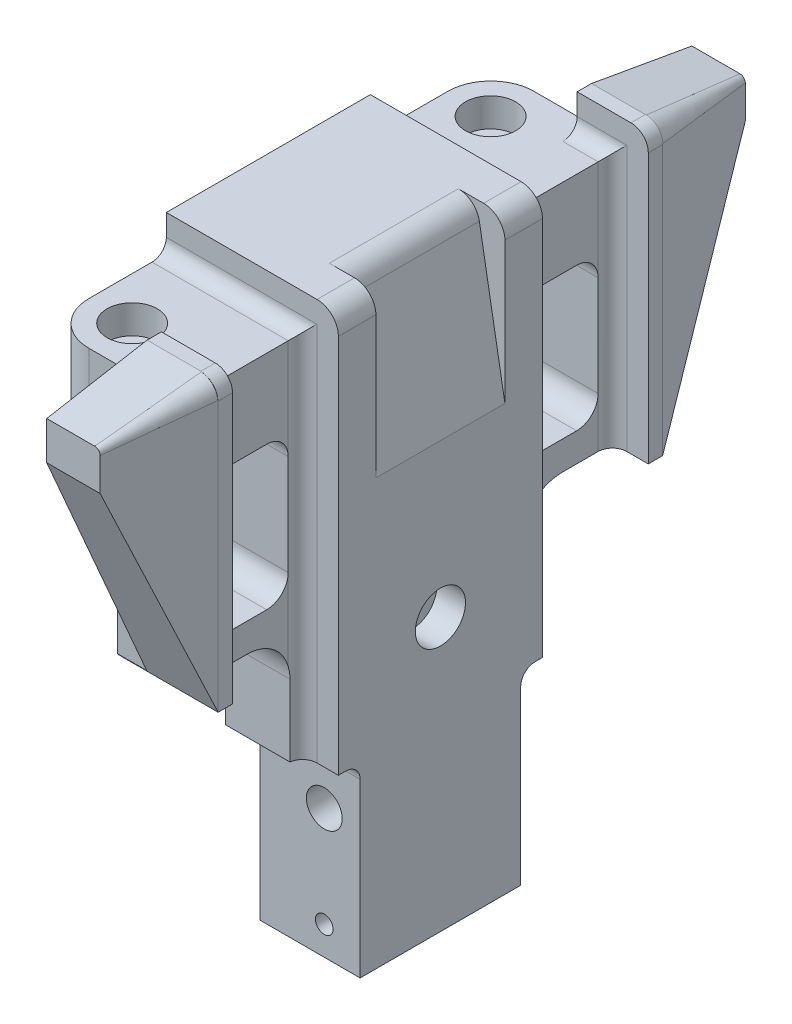
from build123d import *

# Parameters (mm, degrees)
SKETCH1_W                                        = 38.1
SKETCH1_H                                        = 130.175
BOSS_EXTRUDE1_DEPTH                              = 71.4375
CUT_EXTRUDE1_DEPTH                               = 104.881225746
CUT_EXTRUDE2_DEPTH                               = 104.881225746
CUT_EXTRUDE3_DEPTH                               = 104.881225746
CUT_EXTRUDE5_DEPTH                               = 143.857360022
CUT_EXTRUDE5_DEPTH_BACK                          = 143.857360022
SKETCH6_W                                        = 22.352
SKETCH6_H                                        = 28.575
CUT_EXTRUDE6_DEPTH                               = 7.9375
SKETCH7_W                                        = 22.352
SKETCH7_H                                        = 22.1615
CUT_EXTRUDE7_DEPTH                               = 143.857360035
CUT_EXTRUDE8_DEPTH                               = 150.705542767
FILLET1_R                                        = 9.525
CUT_EXTRUDE9_DEPTH                               = 14.2875
FILLET3_R                                        = 4.73075
CUT_EXTRUDE12_DEPTH                              = 104.881225783
CUT_EXTRUDE13_DEPTH                              = 104.881225783
F_5_16_0_3125_DIAMETER_HOLE2_D                   = 7.9375
F_5_16_0_3125_DIAMETER_HOLE2_DEPTH               = 11.684
F_5_16_0_3125_DIAMETER_HOLE2_TIP                 = 2.384665582
F_23_0_154_DIAMETER_HOLE2_D                      = 3.9116
F_23_0_154_DIAMETER_HOLE2_DEPTH                  = 11.684
F_23_0_154_DIAMETER_HOLE2_TIP                    = 1.175163199
F_8_32_TAPPED_HOLE1_REACH                        = 125.996
F_8_32_TAPPED_HOLE1_BORE_R                       = 1.7272
CUT_EXTRUDE14_DEPTH                              = 99.501784584
CUT_EXTRUDE15_DEPTH                              = 104.881225746
FILLET5_R                                        = 3.8354
CBORE_FOR_1_4_SOCKET_HEAD_CAP_SCREW1_D           = 6.7564
CBORE_FOR_1_4_SOCKET_HEAD_CAP_SCREW1_CBORE_D     = 11.1125
CBORE_FOR_1_4_SOCKET_HEAD_CAP_SCREW1_CBORE_DEPTH = 6.35
CBORE_FOR_1_4_SOCKET_HEAD_CAP_SCREW2_D           = 6.7564
CBORE_FOR_1_4_SOCKET_HEAD_CAP_SCREW2_CBORE_D     = 11.1125
CBORE_FOR_1_4_SOCKET_HEAD_CAP_SCREW2_CBORE_DEPTH = 6.35


with BuildPart() as part:
    # Sketch1 → Boss-Extrude1 (new body)
    with BuildSketch(Plane.XY):
        Rectangle(SKETCH1_W, SKETCH1_H)
    extrude(amount=-BOSS_EXTRUDE1_DEPTH)

    # Sketch2 → Cut-Extrude1 (cut, through all)
    with BuildSketch(Plane(origin=(19.05, 0, 0), x_dir=(0, 0, -1), z_dir=(1, 0, 0))):
        with BuildLine():
            Line((71.4375, 1.5875), (34.925, 1.5875))
            ThreePointArc((34.925, 1.5875), (28.189807909, -1.202307909), (25.4, -7.9375))
            Line((25.4, -7.9375), (25.4, -65.0875))
            Line((25.4, -65.0875), (71.4375, -65.0875))
            Line((71.4375, -65.0875), (71.4375, 1.5875))
        make_face()
    extrude(amount=-CUT_EXTRUDE1_DEPTH, mode=Mode.SUBTRACT)

    # Sketch3 → Cut-Extrude2 (cut, through all)
    with BuildSketch(Plane(origin=(19.05, 0, 0), x_dir=(0, 0, -1), z_dir=(1, 0, 0))):
        with BuildLine():
            Line((25.4, -23.8125), (20.955, -23.8125))
            ThreePointArc((20.955, -23.8125), (18.70993597, -24.74243597), (17.78, -26.9875))
            Line((17.78, -26.9875), (17.78, -65.0875))
            Line((17.78, -65.0875), (25.4, -65.0875))
            Line((25.4, -65.0875), (25.4, -23.8125))
        make_face()
    extrude(amount=-CUT_EXTRUDE2_DEPTH, mode=Mode.SUBTRACT)

    # Sketch4 → Cut-Extrude3 (cut, through all)
    with BuildSketch(Plane(origin=(19.05, 0, 0), x_dir=(0, 0, -1), z_dir=(1, 0, 0))):
        with BuildLine():
            Line((22.5933, 65.0875), (46.0375, 65.0875))
            Line((46.0375, 65.0875), (46.0375, 60.325))
            ThreePointArc((46.0375, 60.325), (45.10756403, 58.07993597), (42.8625, 57.15))
            Line((42.8625, 57.15), (25.7683, 57.15))
            ThreePointArc((25.7683, 57.15), (23.52323597, 58.07993597), (22.5933, 60.325))
            Line((22.5933, 60.325), (22.5933, 65.0875))
        make_face()
    extrude(amount=-CUT_EXTRUDE3_DEPTH, mode=Mode.SUBTRACT)

    # Sketch5 → Cut-Extrude5 (cut, two sides: drawn at the far end of the back side and taken through both)
    with BuildSketch(Plane(origin=(0, 57.15, 0), x_dir=(1, 0, 0), z_dir=(0, 1, 0)).offset(-CUT_EXTRUDE5_DEPTH_BACK)):
        with BuildLine():
            Line((19.05, 46.0375), (14.2875, 46.0375))
            ThreePointArc((14.2875, 46.0375), (12.04243597, 45.10756403), (11.1125, 42.8625))
            Line((11.1125, 42.8625), (11.1125, 25.7683))
            ThreePointArc((11.1125, 25.7683), (12.04243597, 23.52323597), (14.2875, 22.5933))
            Line((14.2875, 22.5933), (19.05, 22.5933))
            Line((19.05, 22.5933), (19.05, 46.0375))
        make_face()
    extrude(amount=CUT_EXTRUDE5_DEPTH + CUT_EXTRUDE5_DEPTH_BACK, mode=Mode.SUBTRACT)

    # Sketch6 → Cut-Extrude6 (cut)
    with BuildSketch(Plane(origin=(0, 65.0875, 0), x_dir=(1, 0, 0), z_dir=(0, 1, 0))):
        with Locations((-7.874, 57.15)):
            Rectangle(SKETCH6_W, SKETCH6_H)
    extrude(amount=-CUT_EXTRUDE6_DEPTH, mode=Mode.SUBTRACT)

    # Sketch7 → Cut-Extrude7 (cut, through all)
    with BuildSketch(Plane(origin=(0, 57.15, 0), x_dir=(1, 0, 0), z_dir=(0, 1, 0))):
        with Locations((-7.874, 60.35675)):
            Rectangle(SKETCH7_W, SKETCH7_H)
    extrude(amount=-CUT_EXTRUDE7_DEPTH, mode=Mode.SUBTRACT)

    # Sketch8 → Cut-Extrude8 (cut, through all)
    with BuildSketch(Plane(origin=(0, 65.0875, 0), x_dir=(1, 0, 0), z_dir=(0, 1, 0))):
        Polygon((15.131132854, 71.4375), (19.05, 71.4375), (19.05, 49.2125), align=None)
    extrude(amount=-CUT_EXTRUDE8_DEPTH, mode=Mode.SUBTRACT)

    # Fillet1
    fillet1_edges = [part.edges().sort_by_distance(p)[0] for p in [
        (-19.05, 29.36875, -49.276),
    ]]
    fillet(fillet1_edges, radius=FILLET1_R)

    # Sketch9 → Cut-Extrude9 (cut)
    with BuildSketch(Plane.XY):
        Polygon((12.7, 65.0875), (19.05, 65.0875), (19.05, 29.074860445), align=None)
    extrude(amount=-CUT_EXTRUDE9_DEPTH, mode=Mode.SUBTRACT)

    # Fillet3
    fillet3_edges = [part.edges().sort_by_distance(p)[0] for p in [
        (12.7, 65.0875, -7.14375),
        (19.05, 65.0875, -18.4404),
    ]]
    fillet(fillet3_edges, radius=FILLET3_R)

    # Sketch11 → Cut-Extrude12 (cut, through all)
    with BuildSketch(Plane(origin=(19.05, 0, 0), x_dir=(0, 0, -1), z_dir=(1, 0, 0))):
        Polygon((71.4375, 52.6923), (71.4375, 1.5875), (49.2125, 1.5875), align=None)
    extrude(amount=-CUT_EXTRUDE12_DEPTH, mode=Mode.SUBTRACT)

    # Sketch12 → Cut-Extrude13 (cut, through all)
    with BuildSketch(Plane(origin=(19.05, 0, 0), x_dir=(0, 0, -1), z_dir=(1, 0, 0))):
        with BuildLine():
            Line((30.5308, 39.6875), (38.1, 39.6875))
            ThreePointArc((38.1, 39.6875), (41.467596045, 38.292596045), (42.8625, 34.925))
            Line((42.8625, 34.925), (42.8625, 12.7))
            ThreePointArc((42.8625, 12.7), (41.467596045, 9.332403955), (38.1, 7.9375))
            Line((38.1, 7.9375), (30.5308, 7.9375))
            ThreePointArc((30.5308, 7.9375), (27.163203955, 9.332403955), (25.7683, 12.7))
            Line((25.7683, 12.7), (25.7683, 34.925))
            ThreePointArc((25.7683, 34.925), (27.163203955, 38.292596045), (30.5308, 39.6875))
        make_face()
    extrude(amount=-CUT_EXTRUDE13_DEPTH, mode=Mode.SUBTRACT)

    # 5/16 (0.3125) Diameter Hole2
    with Locations(Plane(origin=(11.1125, -36.5125, -17.78), x_dir=(0, -1, 0), z_dir=(0, 0, -1))):
        with Locations((0, 0)):
            Hole(F_5_16_0_3125_DIAMETER_HOLE2_D / 2, depth=F_5_16_0_3125_DIAMETER_HOLE2_DEPTH)
            with Locations((0, 0, -(F_5_16_0_3125_DIAMETER_HOLE2_DEPTH + F_5_16_0_3125_DIAMETER_HOLE2_TIP / 2))):  # 118° drill point
                Cone(0, F_5_16_0_3125_DIAMETER_HOLE2_D / 2, F_5_16_0_3125_DIAMETER_HOLE2_TIP, mode=Mode.SUBTRACT)

    # #23 (0.154) Diameter Hole2
    with Locations(Plane(origin=(11.1125, -58.7375, -17.78), x_dir=(0, -1, 0), z_dir=(0, 0, -1))):
        with Locations((0, 0)):
            Hole(F_23_0_154_DIAMETER_HOLE2_D / 2, depth=F_23_0_154_DIAMETER_HOLE2_DEPTH)
            with Locations((0, 0, -(F_23_0_154_DIAMETER_HOLE2_DEPTH + F_23_0_154_DIAMETER_HOLE2_TIP / 2))):  # 118° drill point
                Cone(0, F_23_0_154_DIAMETER_HOLE2_D / 2, F_23_0_154_DIAMETER_HOLE2_TIP, mode=Mode.SUBTRACT)

    # #8-32 Tapped Hole1 bore (on position points) → #8-32 Tapped Hole1 (cut, up to next)
    with BuildSketch(Plane(origin=(-19.05, -36.5125, -11.43), x_dir=(0, 0, -1), z_dir=(-1, 0, 0)), mode=Mode.PRIVATE) as f_8_32_tapped_hole1_sk1:
        Circle(F_8_32_TAPPED_HOLE1_BORE_R)
    f_8_32_tapped_hole1_tool1 = extrude(f_8_32_tapped_hole1_sk1.sketch, amount=-F_8_32_TAPPED_HOLE1_REACH, mode=Mode.PRIVATE) & part.part
    # #8-32 Tapped Hole1 bore (on position points) → #8-32 Tapped Hole1 (cut, up to next)
    with BuildSketch(Plane(origin=(-19.05, -36.5125, -11.43), x_dir=(0, 0, -1), z_dir=(-1, 0, 0)), mode=Mode.PRIVATE) as f_8_32_tapped_hole1_sk2:
        with Locations((0, 22.225)):
            Circle(F_8_32_TAPPED_HOLE1_BORE_R)
    f_8_32_tapped_hole1_tool2 = extrude(f_8_32_tapped_hole1_sk2.sketch, amount=-F_8_32_TAPPED_HOLE1_REACH, mode=Mode.PRIVATE) & part.part
    add(f_8_32_tapped_hole1_tool1.solids().sort_by_distance((-19.05, -36.5125, -11.43))[0], mode=Mode.SUBTRACT)
    add(f_8_32_tapped_hole1_tool2.solids().sort_by_distance((-19.05, -58.7375, -11.43))[0], mode=Mode.SUBTRACT)

    # Sketch26 → Cut-Extrude14 (cut, through all)
    with BuildSketch(Plane.XY):
        with BuildLine():
            Line((-19.05, 39.6875), (0, 39.6875))
            ThreePointArc((0, 39.6875), (2.24506403, 38.75756403), (3.175, 36.5125))
            Line((3.175, 36.5125), (3.175, 36.2585))
            ThreePointArc((3.175, 36.2585), (2.24506403, 34.01343597), (0, 33.0835))
            Line((0, 33.0835), (-3.175, 33.0835))
            Line((-3.175, 33.0835), (-3.175, -65.0875))
            Line((-3.175, -65.0875), (-19.05, -65.0875))
            Line((-19.05, -65.0875), (-19.05, 39.6875))
        make_face()
    extrude(amount=-CUT_EXTRUDE14_DEPTH, mode=Mode.SUBTRACT)

    # Sketch28 → Cut-Extrude15 (cut, through all)
    with BuildSketch(Plane(origin=(19.05, 0, 0), x_dir=(0, 0, -1), z_dir=(1, 0, 0))):
        Polygon((71.4375, 65.0875), (71.4375, 61.168632854), (49.2125, 65.0875), align=None)
    extrude(amount=-CUT_EXTRUDE15_DEPTH, mode=Mode.SUBTRACT)

    # Sketch29 for Cut-Loft3 → Cut-Loft3 section 0
    with BuildSketch(Plane(origin=(0, 0, -71.4375), x_dir=(-1, 0, 0), z_dir=(0, 0, -1))):
        with BuildLine():
            Line((-15.131132854, 59.974832854), (-15.131132854, 61.168632854))
            Line((-15.131132854, 61.168632854), (-13.937332854, 61.168632854))
            # circular arc as an exact rational Bezier (weights 1, cos(half-angle), 1)
            Bezier((-13.937332854, 61.168632854), (-15.131132854, 61.168632854), (-15.131132854, 59.974832854), weights=[1, 0.707106781, 1])
        make_face()
    # Sketch27 for Cut-Loft3 → Cut-Loft3 section 1
    with BuildSketch(Plane.XY.offset(-49.276)):
        with BuildLine():
            Line((19.05, 65.0875), (15.08125, 65.0875))
            Bezier((15.08125, 65.0875), (19.05, 65.0875), (19.05, 61.11875), weights=[1, 0.707106781, 1])
            Line((19.05, 61.11875), (19.05, 65.0875))
        make_face()
    loft(mode=Mode.SUBTRACT)

    # Fillet5
    # the kernel refuses this fillet: 3.8354 mm, written as the material it takes off along each edge
    with BuildSketch(Plane(origin=(19.05, 65.0875, -36.449), x_dir=(0, -1, 0), z_dir=(0, 0, -1))) as fillet5_piece_1:
        with BuildLine():
            CenterArc((FILLET5_R, FILLET5_R), FILLET5_R, 180, 90)
            Line((0, FILLET5_R), (0, 0))
            Line((0, 0), (FILLET5_R, 0))
        make_face()
    extrude(amount=22.352, mode=Mode.SUBTRACT)

    # CBORE for 1/4 Socket Head Cap Screw1 (through all)
    with Locations(Plane(origin=(-9.525, 57.15, -39.6875), x_dir=(0, 0, 1), z_dir=(0, 1, 0))):
        with Locations((0, 0)):
            CounterBoreHole(CBORE_FOR_1_4_SOCKET_HEAD_CAP_SCREW1_D / 2, CBORE_FOR_1_4_SOCKET_HEAD_CAP_SCREW1_CBORE_D / 2, CBORE_FOR_1_4_SOCKET_HEAD_CAP_SCREW1_CBORE_DEPTH)

    # Mirror1: part across plane


with BuildPart() as part_1:
    add(part.part)
    add(part.part.mirror(Plane(origin=(0, 0, 0), x_dir=(1, 0, 0), z_dir=(0, 0, -1))))

    # CBORE for 1/4 Socket Head Cap Screw2 (through all)
    with Locations(Plane(origin=(19.05, -4.7625, 0), x_dir=(0, 0, 1), z_dir=(1, 0, 0))):
        with Locations((0, 0)):
            CounterBoreHole(CBORE_FOR_1_4_SOCKET_HEAD_CAP_SCREW2_D / 2, CBORE_FOR_1_4_SOCKET_HEAD_CAP_SCREW2_CBORE_D / 2, CBORE_FOR_1_4_SOCKET_HEAD_CAP_SCREW2_CBORE_DEPTH)


solid = part_1.part
